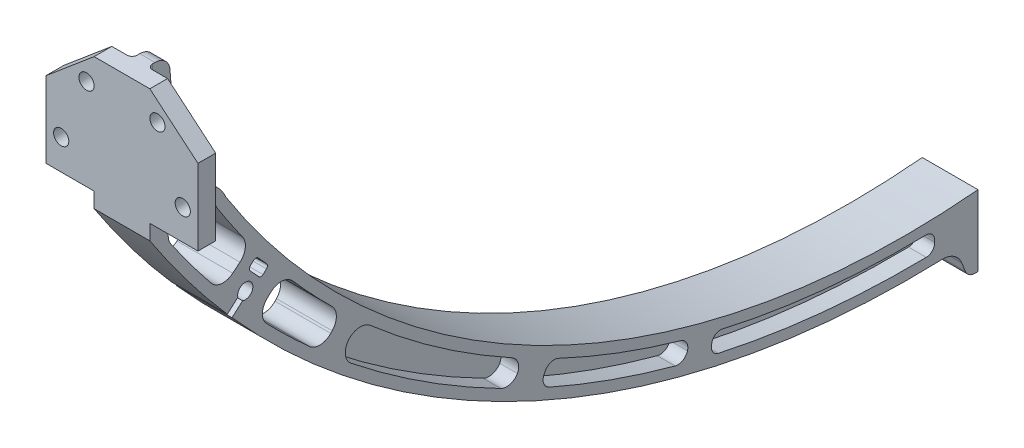
from build123d import *

# Parameters (mm, degrees)
CROQUIS1_R              = 1.5
SALIENTE_EXTRUIR1_DEPTH = 1.75
SALIENTE_EXTRUIR2_DEPTH = 5.5
REDONDEO1_R             = 2
REDONDEO2_R             = 4
CORTAR_EXTRUIR1_DEPTH   = 12.5
REDONDEO3_R             = 3
REDONDEO4_R             = 3
REDONDEO5_R             = 0.6
CORTAR_EXTRUIR2_DEPTH   = 3.5
REDONDEO7_R             = 1.7
REDONDEO8_R             = 2
REDONDEO9_R             = 2.5
REDONDEO10_R            = 3
SALIENTE_EXTRUIR3_DEPTH = 1.5
SALIENTE_EXTRUIR5_START = 4
SALIENTE_EXTRUIR5_DEPTH = 4
SALIENTE_EXTRUIR6_DEPTH = 4
REDONDEO12_R            = 1.7
REDONDEO14_R            = 1.7
REDONDEO15_R            = 1
REDONDEO16_R            = 1


with BuildPart() as part:
    # Croquis1 → Saliente-Extruir1 (new, symmetric)
    with BuildSketch(Plane.XY):
        Polygon((5, 0), (15, 0), (15, 15), (5.5, 23), (-5.5, 23), (-15, 15), (-15, 0), align=None)
        with Locations((12, 6)):
            Circle(CROQUIS1_R, mode=Mode.SUBTRACT)
        with Locations((7, 18)):
            Circle(CROQUIS1_R, mode=Mode.SUBTRACT)
        with Locations(Location((-12, 6, 0), (0, 0, 180))):
            Circle(CROQUIS1_R, mode=Mode.SUBTRACT)
        with Locations(Location((-7, 18, 0), (0, 0, 180))):
            Circle(CROQUIS1_R, mode=Mode.SUBTRACT)
    extrude(amount=SALIENTE_EXTRUIR1_DEPTH, both=True)

    # Croquis3 → Saliente-Extruir2 (add, symmetric)
    with BuildSketch(Plane(origin=(0, 0, 0), x_dir=(0, 0, -1), z_dir=(1, 0, 0))):
        with BuildLine():
            Line((161.75, -76), (161.75, -84))
            Line((161.75, -84), (161.75, -90))
            Line((161.75, -90), (159.75, -90))
            Line((159.75, -90), (157.507836056, -84.26139449))
            ThreePointArc((157.507836056, -84.26139449), (67.037390044, -64.87815795), (-1.75, -3))
            Line((-1.75, -3), (-1.75, 0))
            Line((-1.75, 0), (1.75, 0))
            ThreePointArc((1.75, 0), (8.239161403, 1.333452043), (13.25, -3))
            ThreePointArc((13.25, -3), (77.231791614, -60.388067744), (161.75, -76))
        make_face()
    extrude(amount=SALIENTE_EXTRUIR2_DEPTH, both=True)

    # Redondeo1
    redondeo1_edges = [part.edges().sort_by_distance(p)[0] for p in [
        (0, -90, -159.75),
    ]]
    fillet(redondeo1_edges, radius=REDONDEO1_R)

    # Redondeo2
    redondeo2_edges = [part.edges().sort_by_distance(p)[0] for p in [
        (0, -84.26139449, -157.507836056),
    ]]
    fillet(redondeo2_edges, radius=REDONDEO2_R)

    # Croquis4 → Cortar-Extruir1 (cut, symmetric)
    with BuildSketch(Plane(origin=(5.5, 0, 0), x_dir=(0, 0, -1), z_dir=(1, 0, 0))):
        with BuildLine():
            ThreePointArc((11.465273487, -3.920067745), (6.360823729, -0.423897231), (1.239583985, -3.895427021))
            ThreePointArc((1.239583985, -3.895427021), (6.574820699, -11.418109276), (12.293713241, -18.653423174))
            Line((12.293713241, -18.653423174), (18.197717543, -13.732212029))
            ThreePointArc((18.197717543, -13.732212029), (14.740634402, -8.88848277), (11.465273487, -3.920067745))
        make_face()
        Polygon((21.721829172, -18.902623041), (20.148549946, -20.331869661), (17.639149758, -17.569584183), (19.212428984, -16.140337562), align=None)
        with BuildLine():
            ThreePointArc((16.55979441, -22.399812835), (18.216965567, -20.005291275), (15.633864854, -21.349739286))
            Line((15.633864854, -21.349739286), (15.041949366, -21.871676103))
            ThreePointArc((15.041949366, -21.871676103), (15.50387851, -22.397626074), (15.967878921, -22.921749652))
            Line((15.967878921, -22.921749652), (16.55979441, -22.399812835))
        make_face()
        with BuildLine():
            ThreePointArc((15.967878921, -22.921749652), (15.50387851, -22.397626074), (15.041949366, -21.871676103))
            Line((15.041949366, -21.871676103), (13.541832753, -23.194442789))
            ThreePointArc((13.541832753, -23.194442789), (14.00377344, -23.720382581), (14.467762308, -24.244516338))
            Line((14.467762308, -24.244516338), (15.967878921, -22.921749652))
        make_face()
        with BuildLine():
            ThreePointArc((24.417056397, -21.589163784), (30.187710632, -28.066522162), (36.299521496, -34.223013843))
            Line((36.299521496, -34.223013843), (31.962684157, -38.76730646))
            ThreePointArc((31.962684157, -38.76730646), (25.434077571, -32.779840346), (19.212428984, -26.474006279))
            Line((19.212428984, -26.474006279), (24.417056397, -21.589163784))
        make_face()
    extrude(amount=CORTAR_EXTRUIR1_DEPTH, both=True, mode=Mode.SUBTRACT)

    # Redondeo3
    redondeo3_edges = [part.edges().sort_by_distance(p)[0] for p in [
        (0, -21.589163784, -24.417056397),
        (0, -34.223013843, -36.299521496),
        (0, -38.76730646, -31.962684157),
        (0, -26.474006279, -19.212428984),
    ]]
    fillet(redondeo3_edges, radius=REDONDEO3_R)

    # Redondeo4
    redondeo4_edges = [part.edges().sort_by_distance(p)[0] for p in [
        (0, -3.895427021, -1.239583985),
        (0, -13.732212029, -18.197717543),
        (0, -18.653423174, -12.293713241),
    ]]
    fillet(redondeo4_edges, radius=REDONDEO4_R)

    # Redondeo5
    redondeo5_edges = [part.edges().sort_by_distance(p)[0] for p in [
        (0, -18.902623041, -21.721829172),
        (0, -20.331869661, -20.148549946),
        (0, -17.569584183, -17.639149758),
        (0, -16.140337562, -19.212428984),
    ]]
    fillet(redondeo5_edges, radius=REDONDEO5_R)

    # Croquis5 → Cortar-Extruir2 (cut)
    with BuildSketch(Plane(origin=(5.5, 0, 0), x_dir=(0, 0, -1), z_dir=(1, 0, 0))):
        with BuildLine():
            ThreePointArc((108.988376287, -78.006437101), (130.986350115, -81.607186135), (153.262191471, -82.421519016))
            Line((153.262191471, -82.421519016), (153.120638737, -78.557214321))
            ThreePointArc((153.120638737, -78.557214321), (131.097879237, -77.852221969), (109.378608301, -74.141127759))
            Line((109.378608301, -74.141127759), (108.988376287, -78.006437101))
        make_face()
        with BuildLine():
            ThreePointArc((77.140746676, -62.569213348), (90.785661548, -68.421946592), (104.912532209, -72.990284758))
            Line((104.912532209, -72.990284758), (103.883830733, -76.757766184))
            ThreePointArc((103.883830733, -76.757766184), (89.319424318, -72.289818403), (75.191942144, -66.589051873))
            Line((75.191942144, -66.589051873), (77.140746676, -62.569213348))
        make_face()
        with BuildLine():
            ThreePointArc((39.564436142, -37.253526903), (55.048712453, -49.588708156), (71.932300266, -59.926211336))
            Line((71.932300266, -59.926211336), (69.764991978, -64.011497027))
            ThreePointArc((69.764991978, -64.011497027), (51.98587772, -53.878112573), (35.491736953, -41.765073953))
            Line((35.491736953, -41.765073953), (39.564436142, -37.253526903))
        make_face()
    cortar_extruir2 = extrude(amount=-CORTAR_EXTRUIR2_DEPTH, mode=Mode.SUBTRACT)

    # Simetría1: Cortar-Extruir2 across plane
    add(cortar_extruir2.mirror(Plane(origin=(0, 0, 0), x_dir=(0, 0, 1), z_dir=(1, 0, 0))), mode=Mode.SUBTRACT)

    # Redondeo7
    redondeo7_edges = [part.edges().sort_by_distance(p)[0] for p in [
        (3.75, -74.141127759, -109.378608301),
        (3.75, -78.557214321, -153.120638737),
        (3.75, -82.421519016, -153.262191471),
        (3.75, -78.006437101, -108.988376287),
        (-3.75, -78.557214321, -153.120638737),
        (-3.75, -74.141127759, -109.378608301),
        (-3.75, -78.006437101, -108.988376287),
        (-3.75, -82.421519016, -153.262191471),
    ]]
    fillet(redondeo7_edges, radius=REDONDEO7_R)

    # Redondeo8
    # the kernel refuses this fillet: 2 mm, written as the material it adds along each edge
    with BuildSketch(Plane(origin=(-5.5, -76.757766184, -103.883830733), x_dir=(0, 0.25741805826829556, 0.9663001310552434), z_dir=(1, 0, 0))) as redondeo8_piece_1:
        with BuildLine():
            CenterArc((1.9876368, -1.999968274), REDONDEO8_R, 89.67727476, 89.967443024)
            Line((-0.01232475, -1.987566664), (0, 0))
            ThreePointArc((0, 0), (0.999450988, 0.00281477), (1.998901976, 0))
        make_face()
    extrude(amount=8.497254941)
    with BuildSketch(Plane(origin=(-5.5, -66.589051873, -75.191942144), x_dir=(0, -0.4083412591391186, -0.912829346638614), z_dir=(1, 0, 0))) as redondeo8_piece_2:
        with BuildLine():
            CenterArc((2.062515859, 1.999965838), REDONDEO8_R, 178.236722446, 92.098160766)
            Line((0.063462885, 2.061506121), (0, 0))
            ThreePointArc((0, 0), (1.037102711, -0.003030845), (2.074205422, 0))
        make_face()
    extrude(amount=8.685513555)
    with BuildSketch(Plane(origin=(-5.5, -62.569213348, -77.140746676), x_dir=(0, -0.8998323919022363, 0.43623579229987575), z_dir=(1, 0, 0))) as redondeo8_piece_3:
        with BuildLine():
            CenterArc((1.987706041, 2), REDONDEO8_R, 180.704383106, 89.295616894)
            ThreePointArc((-0.012142824, 1.975413011), (-0.003035735, 0.987725166), (0, 0))
            Line((0, 0), (1.987706041, 0))
        make_face()
    extrude(amount=8.469265102)
    with BuildSketch(Plane(origin=(-5.5, -72.990284758, -104.912532209), x_dir=(0, 0.26932976065899844, 0.9630480154298469), z_dir=(1, 0, 0))) as redondeo8_piece_4:
        with BuildLine():
            CenterArc((1.987744058, 1.999962216), REDONDEO8_R, 180.352191553, 89.295616894)
            Line((-0.012218158, 1.987668489), (0, 0))
            ThreePointArc((0, 0), (0.987725166, 0.003035735), (1.975450331, 0))
        make_face()
    extrude(amount=8.469265102)
    with BuildSketch(Plane(origin=(5.5, -62.569213348, -77.140746676), x_dir=(0, -0.8998323919022363, 0.43623579229987575), z_dir=(-1, 0, 0))) as redondeo8_piece_5:
        with BuildLine():
            CenterArc((1.987706041, -2), REDONDEO8_R, 90, 89.295616894)
            ThreePointArc((-0.012142824, -1.975413011), (-0.003035735, -0.987725166), (0, 0))
            Line((0, 0), (1.987706041, 0))
        make_face()
    extrude(amount=8.469265102)
    with BuildSketch(Plane(origin=(5.5, -66.589051873, -75.191942144), x_dir=(0, -0.4083412591391186, -0.912829346638614), z_dir=(-1, 0, 0))) as redondeo8_piece_6:
        with BuildLine():
            CenterArc((2.062515859, -1.999965838), REDONDEO8_R, 89.665116788, 92.098160766)
            Line((0.063462885, -2.061506121), (0, 0))
            ThreePointArc((0, 0), (1.037102711, 0.003030845), (2.074205422, 0))
        make_face()
    extrude(amount=8.685513555)
    with BuildSketch(Plane(origin=(5.5, -76.757766184, -103.883830733), x_dir=(0, 0.25741805826829556, 0.9663001310552434), z_dir=(-1, 0, 0))) as redondeo8_piece_7:
        with BuildLine():
            CenterArc((1.9876368, 1.999968274), REDONDEO8_R, 180.355282216, 89.967443024)
            Line((-0.01232475, 1.987566664), (0, 0))
            ThreePointArc((0, 0), (0.999450988, -0.00281477), (1.998901976, 0))
        make_face()
    extrude(amount=8.497254941)
    with BuildSketch(Plane(origin=(5.5, -72.990284758, -104.912532209), x_dir=(0, 0.26932976065899844, 0.9630480154298469), z_dir=(-1, 0, 0))) as redondeo8_piece_8:
        with BuildLine():
            CenterArc((1.987744058, -1.999962216), REDONDEO8_R, 90.352191553, 89.295616894)
            Line((-0.012218158, -1.987668489), (0, 0))
            ThreePointArc((0, 0), (0.987725166, -0.003035735), (1.975450331, 0))
        make_face()
    extrude(amount=8.469265102)

    # Redondeo9
    # the kernel refuses this fillet: 2.5 mm, written as the material it adds along each edge
    with BuildSketch(Plane(origin=(-5.5, -64.011497027, -69.764991978), x_dir=(0, 0.8833843219967678, -0.46864927147101265), z_dir=(1, 0, 0))) as redondeo9_piece_1:
        with BuildLine():
            CenterArc((2.449284582, 2.5), REDONDEO9_R, 180.774511448, 89.225488552)
            ThreePointArc((-0.050487008, 2.466206592), (-0.029529104, 1.233015563), (0, 0))
            Line((0, 0), (2.449284582, 0))
        make_face()
    extrude(amount=9.666808277)
    with BuildSketch(Plane(origin=(-5.5, -59.926211336, -71.932300266), x_dir=(0, 0.4754023491772276, 0.8797684959105851), z_dir=(1, 0, 0))) as redondeo9_piece_2:
        with BuildLine():
            CenterArc((2.480923057, 2.499926652), REDONDEO9_R, 180.43889668, 89.122206639)
            Line((-0.019003595, 2.480776359), (0, 0))
            ThreePointArc((0, 0), (1.230886382, 0.004714436), (2.461772764, 0))
        make_face()
    extrude(amount=9.702122863)
    with BuildSketch(Plane(origin=(5.5, -64.011497027, -69.764991978), x_dir=(0, 0.8833843219967678, -0.46864927147101265), z_dir=(-1, 0, 0))) as redondeo9_piece_3:
        with BuildLine():
            CenterArc((2.449284582, -2.5), REDONDEO9_R, 90, 89.225488552)
            ThreePointArc((-0.050487008, -2.466206592), (-0.029529104, -1.233015563), (0, 0))
            Line((0, 0), (2.449284582, 0))
        make_face()
    extrude(amount=9.666808277)
    with BuildSketch(Plane(origin=(5.5, -59.926211336, -71.932300266), x_dir=(0, -0.8833843219967673, 0.4686492714710136), z_dir=(-1, 0, 0))) as redondeo9_piece_4:
        with BuildLine():
            CenterArc((2.480849145, 2.5), REDONDEO9_R, 180.877793361, 89.122206639)
            ThreePointArc((-0.018857468, 2.461700538), (-0.004714436, 1.230886382), (0, 0))
            Line((0, 0), (2.480849145, 0))
        make_face()
    extrude(amount=9.702122863)

    # Redondeo10
    # the kernel refuses this fillet: 3 mm, written as the material it adds along each edge
    with BuildSketch(Plane(origin=(-5.5, -37.253526903, -39.564436142), x_dir=(0, -0.7422864731030836, 0.6700826753828107), z_dir=(1, 0, 0))) as redondeo10_piece_1:
        with BuildLine():
            CenterArc((2.97250631, 3), REDONDEO10_R, 181.050152183, 88.949847817)
            ThreePointArc((-0.026989797, 2.945017239), (-0.006747591, 1.472570456), (0, 0))
            Line((0, 0), (2.97250631, 0))
        make_face()
    extrude(amount=10.931265776)
    with BuildSketch(Plane(origin=(-5.5, -41.765073953, -35.491736953), x_dir=(0, 0.7422864731030844, -0.6700826753828096), z_dir=(1, 0, 0))) as redondeo10_piece_2_section:
        with BuildLine():
            CenterArc((3.160630655, -3), REDONDEO10_R, 90, 93.504008371)
            ThreePointArc((0.16623908, -3.183355105), (0.075970844, -1.592050867), (0, 0))
            Line((0, 0), (3.160630655, 0))
        make_face()
    redondeo10_piece_2 = extrude(amount=11.469231908, mode=Mode.PRIVATE)
    redondeo10_piece_2 = split(redondeo10_piece_2, bisect_by=Plane(origin=(5.5, -41.692447795, -36.535617694), z_dir=(-1, 0, 0)), keep=Keep.TOP, mode=Mode.PRIVATE)
    add(redondeo10_piece_2)
    with BuildSketch(Plane(origin=(5.5, -37.253526903, -39.564436142), x_dir=(0, -0.7422864731030836, 0.6700826753828107), z_dir=(-1, 0, 0))) as redondeo10_piece_3:
        with BuildLine():
            CenterArc((2.97250631, -3), REDONDEO10_R, 90, 88.949847817)
            ThreePointArc((-0.026989797, -2.945017239), (-0.006747591, -1.472570456), (0, 0))
            Line((0, 0), (2.97250631, 0))
        make_face()
    extrude(amount=10.931265776)
    with BuildSketch(Plane(origin=(5.5, -41.765073953, -35.491736953), x_dir=(0, -0.6304604094587443, -0.7762214066264294), z_dir=(-1, 0, 0))) as redondeo10_piece_4_section:
        with BuildLine():
            CenterArc((3.160745528, -2.999878972), REDONDEO10_R, 89.485338792, 93.504008371)
            Line((0.164827783, -3.156329821), (0, 0))
            ThreePointArc((0, 0), (1.593846382, 0.007158437), (3.187692763, 0))
        make_face()
    redondeo10_piece_4 = extrude(amount=11.469231908, mode=Mode.PRIVATE)
    redondeo10_piece_4 = split(redondeo10_piece_4, bisect_by=Plane(origin=(-5.5, -41.692447795, -36.535617694), z_dir=(1, 0, 0)), keep=Keep.TOP, mode=Mode.PRIVATE)
    add(redondeo10_piece_4)

    # Croquis6 → Saliente-Extruir3 (add, symmetric)
    with BuildSketch(Plane(origin=(0, 0, 0), x_dir=(0, 0, -1), z_dir=(1, 0, 0))):
        with BuildLine():
            Line((1.75, 23), (3.261540901, 23))
            ThreePointArc((3.261540901, 23), (5.176846854, 22.309026442), (6.20986896, 20.554402072))
            ThreePointArc((6.20986896, 20.554402072), (6.862639483, 13.544547864), (8.202889971, 6.633115739))
            ThreePointArc((8.202889971, 6.633115739), (8.81714512, 4.759448861), (9.707706106, 3.000233671))
            Line((9.707706106, 3.000233671), (12.33489048, -1.337917246))
            Line((12.33489048, -1.337917246), (12.300396942, -1.365700462))
            ThreePointArc((12.300396942, -1.365700462), (7.309585427, 1.51411415), (1.75, 0))
            Line((1.75, 0), (1.75, 23))
        make_face()
    extrude(amount=SALIENTE_EXTRUIR3_DEPTH, both=True)

    # Croquis7 → Saliente-Extruir5 (add)
    with BuildSketch(Plane(origin=(1.5, 0, 0), x_dir=(0, 0, -1), z_dir=(1, 0, 0)).offset(SALIENTE_EXTRUIR5_START)):
        with BuildLine():
            ThreePointArc((4.75, 1.403843596), (3.332263709, 3.415264), (1.75, 5.3))
            Line((1.75, 5.3), (1.75, 0))
            ThreePointArc((1.75, 0), (3.171466781, 0.869746517), (4.75, 1.403843596))
        make_face()
    extrude(amount=-SALIENTE_EXTRUIR5_DEPTH)

    # Croquis8 → Saliente-Extruir6 (add)
    with BuildSketch(Plane.ZY.offset(1.5)):
        with BuildLine():
            ThreePointArc((-4.75, 1.403843596), (-3.171466781, 0.869746517), (-1.75, 0))
            Line((-1.75, 0), (-1.75, 5.3))
            ThreePointArc((-1.75, 5.3), (-3.409999131, 3.475119468), (-4.75, 1.403843596))
        make_face()
    extrude(amount=SALIENTE_EXTRUIR6_DEPTH)

    # Redondeo12
    redondeo12_edges = [part.edges().sort_by_distance(p)[0] for p in [
        (5.5, 2.65, -1.75),
    ]]
    fillet(redondeo12_edges, radius=REDONDEO12_R)

    # Redondeo14
    redondeo14_edges = [part.edges().sort_by_distance(p)[0] for p in [
        (-5.5, 2.65, -1.75),
    ]]
    fillet(redondeo14_edges, radius=REDONDEO14_R)

    # Redondeo15
    # the kernel refuses this fillet: 1 mm, written as the material it adds along each edge
    with BuildSketch(Plane(origin=(1.5, -5.917588358, -6.347585646), x_dir=(0, 0.31374623022812304, -0.9495068736021038), z_dir=(0, -0.9495068736021038, -0.31374623022812304))) as redondeo15_piece_1_section:
        with BuildLine():
            CenterArc((7.493707076 + REDONDEO15_R, REDONDEO15_R), REDONDEO15_R, 180, 90)
            Line((7.493707076, REDONDEO15_R), (7.493707076, 0))
            Line((7.493707076, 0), (7.493707076 + REDONDEO15_R, 0))
        make_face()
    redondeo15_piece_1 = revolve(axis=Axis((1.5, -5.917588358, -6.347585646), (1, 0, 0)), revolution_arc=103.142860664, mode=Mode.PRIVATE)
    redondeo15_piece_1 = split(redondeo15_piece_1, bisect_by=Plane(origin=(1.751806466, -0.520097195, -11.839618624), z_dir=(0, -0.5180135628300192, 0.8553724035320229)), keep=Keep.TOP, mode=Mode.PRIVATE)
    redondeo15_piece_1 = split(redondeo15_piece_1, bisect_by=Plane(origin=(1.751806466, -1.292410293, -12.391388468), z_dir=(0, 0.7787896992571463, 0.6272851060968718)), keep=Keep.TOP, mode=Mode.PRIVATE)
    add(redondeo15_piece_1)
    with BuildSketch(Plane(origin=(1.5, -14.377077794, 19.774985102), x_dir=(0, 0.46713013510673285, -0.8841885754041191), z_dir=(0, -0.8841885754041191, -0.46713013510673285))) as redondeo15_piece_2_section:
        with BuildLine():
            CenterArc((29.163545295 + REDONDEO15_R, REDONDEO15_R), REDONDEO15_R, 180, 90)
            Line((29.163545295, REDONDEO15_R), (29.163545295, 0))
            Line((29.163545295, 0), (29.163545295 + REDONDEO15_R, 0))
        make_face()
    redondeo15_piece_2 = revolve(axis=Axis((1.5, -14.377077794, 19.774985102), (1, 0, 0)), revolution_arc=19.495459617, mode=Mode.PRIVATE)
    redondeo15_piece_2 = redondeo15_piece_2 - Plane(origin=(1.71684341, -5.917588358, -6.347585646), x_dir=(0, 0.7896743624565424, 0.6135262026016927), z_dir=(1, 0, 0)) * Cylinder(7.493707076, 121, mode=Mode.PRIVATE)
    add(redondeo15_piece_2)
    with BuildSketch(Plane(origin=(1.5, 2.8, -1.75), x_dir=(0, 0, -1), z_dir=(0, 1, 0))) as redondeo15_piece_3:
        with BuildLine():
            CenterArc((REDONDEO15_R, -REDONDEO15_R), REDONDEO15_R, 90, 90)
            Line((0, -REDONDEO15_R), (0, 0))
            Line((0, 0), (REDONDEO15_R, 0))
        make_face()
    extrude(amount=20.2)

    # Redondeo16
    redondeo16_edges = [part.edges().sort_by_distance(p)[0] for p in [
        (-1.5, 1.117754886, -8.928204019),
        (-1.5, 3.475119468, -3.409999131),
        (-1.5, 14.15, -1.75),
    ]]
    fillet(redondeo16_edges, radius=REDONDEO16_R)


solid = part.part
